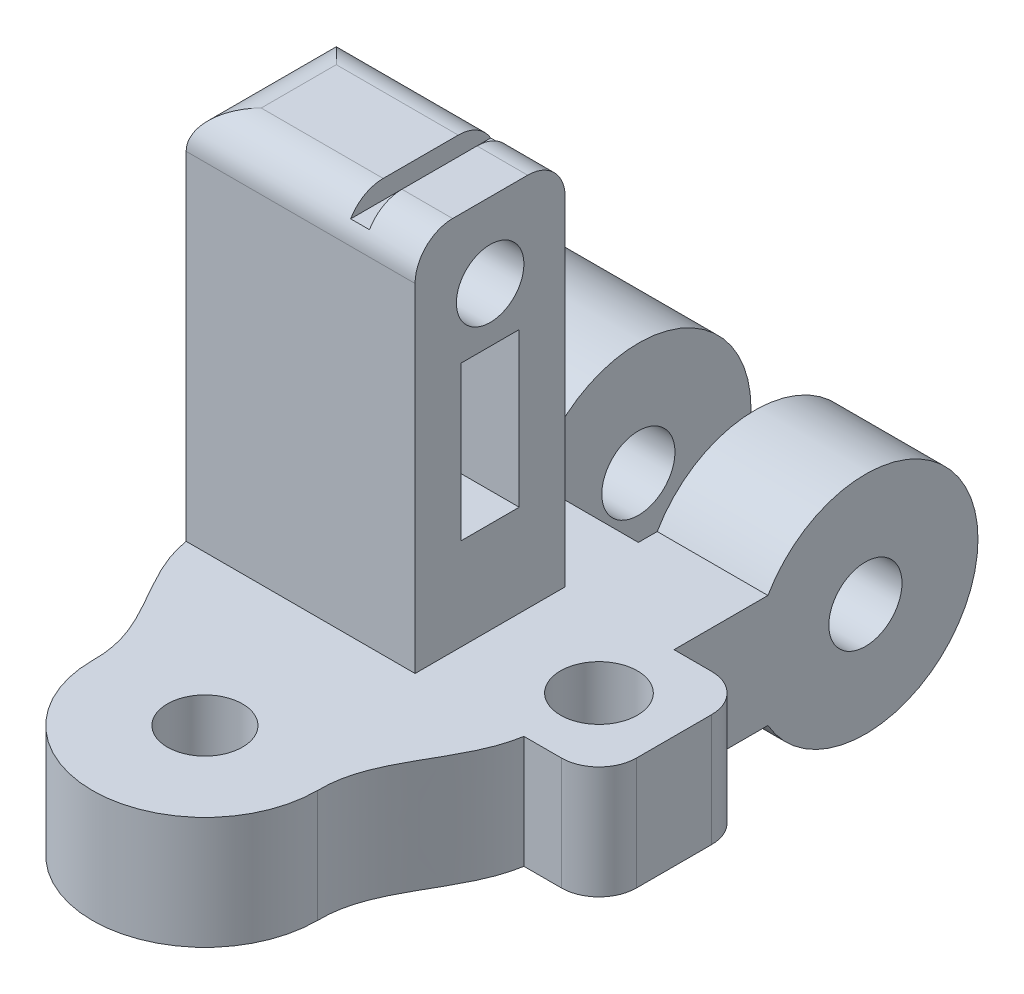
from build123d import *

# Parameters (mm, degrees)
SKETCH1_W           = 9
SKETCH1_H           = 9
BOSS_EXTRUDE1_DEPTH = 3
SKETCH2_W           = 2.95
SKETCH2_H           = 6
BOSS_EXTRUDE2_DEPTH = 6.1
FILLET1_R           = 3
SKETCH3_R           = 0.975
CUT_EXTRUDE1_DEPTH  = 11.1
CUT_EXTRUDE3_DEPTH  = 21.1
BOSS_EXTRUDE3_START = 4
SKETCH5_R           = 3
BOSS_EXTRUDE3_DEPTH = 4
SKETCH8_R           = 1.55
CUT_EXTRUDE4_DEPTH  = 5
CUT_EXTRUDE5_DEPTH  = 0.5
SKETCH10_W          = 9
SKETCH10_H          = 3
BOSS_EXTRUDE4_DEPTH = 4
SKETCH11_R          = 1
CUT_EXTRUDE6_DEPTH  = 4
CUT_EXTRUDE7_DEPTH  = 4
SKETCH13_W          = 6.1
SKETCH13_H          = 4
BOSS_EXTRUDE7_DEPTH = 7.5
SKETCH16_W          = 1.55
SKETCH16_H          = 4.1
CUT_EXTRUDE9_DEPTH  = 3.2
SKETCH17_W          = 4
SKETCH17_H          = 3
BOSS_EXTRUDE8_DEPTH = 2
SKETCH19_R          = 1.025
CUT_EXTRUDE10_DEPTH = 4
FILLET2_R           = 1
SKETCH21_W          = 6.1
SKETCH21_H          = 4
BOSS_EXTRUDE9_DEPTH = 2.5
SKETCH23_R          = 0.9
CUT_EXTRUDE11_DEPTH = 4
FILLET3_R           = 1
CUT_EXTRUDE12_DEPTH = 0.5


with BuildPart() as part:
    # Sketch1 → Boss-Extrude1 (new body)
    with BuildSketch(Plane(origin=(0, 0, 0), x_dir=(1, 0, 0), z_dir=(0, 1, 0))):
        with Locations((4.5, 4.5)):
            Rectangle(SKETCH1_W, SKETCH1_H)
    extrude(amount=BOSS_EXTRUDE1_DEPTH)

    # Sketch2 → Boss-Extrude2 (add)
    with BuildSketch(Plane(origin=(0, 0, -9), x_dir=(-1, 0, 0), z_dir=(0, 0, -1))):
        with Locations((-7.525, 1.5)):
            Rectangle(SKETCH2_W, SKETCH2_H)
        with Locations((-1.475, 1.5)):
            Rectangle(SKETCH2_W, SKETCH2_H)
    extrude(amount=BOSS_EXTRUDE2_DEPTH)

    # Fillet1
    fillet1_edges = [part.edges().sort_by_distance(p)[0] for p in [
        (1.475, 4.5, -15.1),
        (1.475, -1.5, -15.1),
        (7.525, -1.5, -15.1),
        (7.525, 4.5, -15.1),
    ]]
    fillet(fillet1_edges, radius=FILLET1_R - 0.0001)  # a hair under: the kernel refuses the full size

    # Sketch3 → Cut-Extrude1 (cut)
    with BuildSketch(Plane(origin=(9, 0, 0), x_dir=(0, 0, -1), z_dir=(1, 0, 0))):
        with Locations((12.1, 1.5)):
            Circle(SKETCH3_R)
    extrude(amount=-CUT_EXTRUDE1_DEPTH, mode=Mode.SUBTRACT)

    # Sketch6 → Cut-Extrude3 (cut)
    with BuildSketch(Plane.ZY):
        with BuildLine():
            Line((-12.1, 4.5), (-9, 4.5))
            Line((-9, 4.5), (-9, 3))
            Line((-9, 3), (-9.501923789, 3))
            ThreePointArc((-9.501923789, 3), (-10.6, 4.098076211), (-12.1, 4.5))
        make_face()
        with BuildLine():
            Line((-12.1, -1.5), (-9, -1.5))
            Line((-9, -1.5), (-9, 0))
            Line((-9, 0), (-9.501923789, 0))
            ThreePointArc((-9.501923789, 0), (-10.6, -1.098076211), (-12.1, -1.5))
        make_face()
    extrude(amount=-CUT_EXTRUDE3_DEPTH, mode=Mode.SUBTRACT)

    # Sketch5 → Boss-Extrude3 (add)
    with BuildSketch(Plane.ZY.offset(BOSS_EXTRUDE3_START)):
        with Locations((-12.1, 1.5)):
            Circle(SKETCH5_R)
    extrude(amount=-BOSS_EXTRUDE3_DEPTH)

    # Sketch8 → Cut-Extrude4 (cut)
    with BuildSketch(Plane(origin=(0, -1.5, 0), x_dir=(-1, 0, 0), z_dir=(0, -1, 0))):
        with Locations(Location((1.6, 12.1, 0), (0, 0, 90))):
            Circle(SKETCH8_R)
    extrude(amount=-CUT_EXTRUDE4_DEPTH, mode=Mode.SUBTRACT)

    # Sketch9 → Cut-Extrude5 (cut)
    with BuildSketch(Plane.ZY.offset(4)):
        with BuildLine():
            Line((-11.85, 1.5), (-11.85, -0.8))
            ThreePointArc((-11.85, -0.8), (-12.1, -1.05), (-12.35, -0.8))
            Line((-12.35, -0.8), (-12.35, 0.896446609))
            Line((-12.35, 0.896446609), (-13.549568901, -0.303122292))
            ThreePointArc((-13.549568901, -0.303122292), (-13.903122292, -0.303122292), (-13.903122292, 0.050431099))
            Line((-13.903122292, 0.050431099), (-12.703553391, 1.25))
            Line((-12.703553391, 1.25), (-14.4, 1.25))
            ThreePointArc((-14.4, 1.25), (-14.65, 1.5), (-14.4, 1.75))
            Line((-14.4, 1.75), (-12.703553391, 1.75))
            Line((-12.703553391, 1.75), (-13.903122292, 2.949568901))
            ThreePointArc((-13.903122292, 2.949568901), (-13.903122292, 3.303122292), (-13.549568901, 3.303122292))
            Line((-13.549568901, 3.303122292), (-12.35, 2.103553391))
            Line((-12.35, 2.103553391), (-12.35, 3.8))
            ThreePointArc((-12.35, 3.8), (-12.1, 4.05), (-11.85, 3.8))
            Line((-11.85, 3.8), (-11.85, 1.5))
        make_face()
    extrude(amount=-CUT_EXTRUDE5_DEPTH, mode=Mode.SUBTRACT)

    # Sketch10 → Boss-Extrude4 (add)
    with BuildSketch(Plane.XY):
        with Locations((4.5, 1.5)):
            Rectangle(SKETCH10_W, SKETCH10_H)
    extrude(amount=BOSS_EXTRUDE4_DEPTH)

    # Sketch11 → Cut-Extrude6 (cut)
    with BuildSketch(Plane(origin=(0, 3, 0), x_dir=(1, 0, 0), z_dir=(0, 1, 0))):
        with Locations(Location((4.5, -1, 0), (0, 0, 270))):
            Circle(SKETCH11_R)
    extrude(amount=-CUT_EXTRUDE6_DEPTH, mode=Mode.SUBTRACT)

    # Sketch12 → Cut-Extrude7 (cut)
    with BuildSketch(Plane(origin=(0, 3, 0), x_dir=(1, 0, 0), z_dir=(0, 1, 0))):
        with BuildLine():
            add(Edge.make_bspline(
                [(1.5, -1), (1.53988428, 0.555027292), (0.235256098, 1.545486909), (0, 3)],
                knots=[0, 0, 0, 0, 1, 1, 1, 1], degree=3))
            Line((0, 3), (0, -4))
            Line((0, -4), (4.5, -4))
            ThreePointArc((4.5, -4), (2.378679656, -3.121320344), (1.5, -1))
        make_face()
        with BuildLine():
            ThreePointArc((7.5, -1), (6.621320344, -3.121320344), (4.5, -4))
            Line((4.5, -4), (9, -4))
            Line((9, -4), (9, 3))
            add(Edge.make_bspline(
                [(7.5, -1), (7.46011572, 0.555027292), (8.764743902, 1.545486909), (9, 3)],
                knots=[0, 0, 0, 0, 1, 1, 1, 1], degree=3))
        make_face()
    extrude(amount=-CUT_EXTRUDE7_DEPTH, mode=Mode.SUBTRACT)

    # Sketch13 → Boss-Extrude7 (add)
    with BuildSketch(Plane(origin=(0, 3, 0), x_dir=(1, 0, 0), z_dir=(0, 1, 0))):
        with Locations((3.05, 5)):
            Rectangle(SKETCH13_W, SKETCH13_H)
    extrude(amount=BOSS_EXTRUDE7_DEPTH)

    # Sketch16 → Cut-Extrude9 (cut)
    with BuildSketch(Plane(origin=(6.1, 0, 0), x_dir=(0, 0, -1), z_dir=(1, 0, 0))):
        with Locations((5, 7.5)):
            Rectangle(SKETCH16_W, SKETCH16_H)
    extrude(amount=-CUT_EXTRUDE9_DEPTH, mode=Mode.SUBTRACT)

    # Sketch17 → Boss-Extrude8 (add)
    with BuildSketch(Plane(origin=(9, 0, 0), x_dir=(0, 0, -1), z_dir=(1, 0, 0))):
        with Locations((5, 1.5)):
            Rectangle(SKETCH17_W, SKETCH17_H)
    extrude(amount=BOSS_EXTRUDE8_DEPTH)

    # Sketch19 → Cut-Extrude10 (cut)
    with BuildSketch(Plane(origin=(0, 3, 0), x_dir=(1, 0, 0), z_dir=(0, 1, 0))):
        with Locations(Location((9, 5, 0), (0, 0, 270))):
            Circle(SKETCH19_R)
    extrude(amount=-CUT_EXTRUDE10_DEPTH, mode=Mode.SUBTRACT)

    # Fillet2
    fillet2_edges = [part.edges().sort_by_distance(p)[0] for p in [
        (11, 1.5, -3),
        (11, 1.5, -7),
    ]]
    fillet(fillet2_edges, radius=FILLET2_R)

    # Sketch21 → Boss-Extrude9 (add)
    with BuildSketch(Plane(origin=(0, 10.5, 0), x_dir=(1, 0, 0), z_dir=(0, 1, 0))):
        with Locations((3.05, 5)):
            Rectangle(SKETCH21_W, SKETCH21_H)
    extrude(amount=BOSS_EXTRUDE9_DEPTH)

    # Sketch23 → Cut-Extrude11 (cut)
    with BuildSketch(Plane(origin=(6.1, 0, 0), x_dir=(0, 0, -1), z_dir=(1, 0, 0))):
        with Locations((5, 11)):
            Circle(SKETCH23_R)
    extrude(amount=-CUT_EXTRUDE11_DEPTH, mode=Mode.SUBTRACT)

    # Fillet3
    fillet3_edges = [part.edges().sort_by_distance(p)[0] for p in [
        (3.05, 13, -7),
        (0, 13, -5),
        (3.05, 13, -3),
    ]]
    fillet(fillet3_edges, radius=FILLET3_R)

    # Sketch24 → Cut-Extrude12 (cut)
    with BuildSketch(Plane(origin=(0, 13, 0), x_dir=(1, 0, 0), z_dir=(0, 1, 0))):
        with BuildLine():
            Line((4.25, 3), (4.25, 7))
            ThreePointArc((4.25, 7), (4.5, 7.25), (4.75, 7))
            Line((4.75, 7), (4.75, 3))
            ThreePointArc((4.75, 3), (4.5, 2.75), (4.25, 3))
        make_face()
    extrude(amount=-CUT_EXTRUDE12_DEPTH, mode=Mode.SUBTRACT)


solid = part.part
